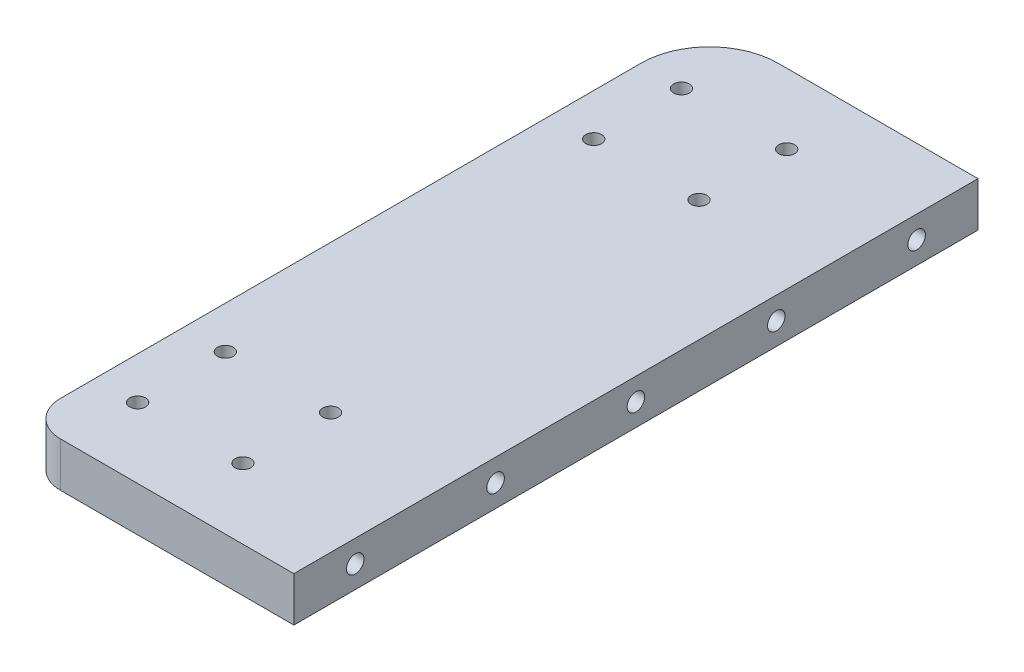
from build123d import *

# Parameters (mm, degrees)
SKETCH1_R                       = 2.25
BOSS_EXTRUDE1_DEPTH             = 12.7
TAP_DRILL_FOR_M6X1_0_TAP1_D     = 5
TAP_DRILL_FOR_M6X1_0_TAP1_DEPTH = 17
TAP_DRILL_FOR_M6X1_0_TAP1_TIP   = 1.502151548


with BuildPart() as part:
    # Sketch1 → Boss-Extrude1 (new body)
    with BuildSketch(Plane(origin=(0, 0, 0), x_dir=(1, 0, 0), z_dir=(0, 1, 0))):
        with BuildLine():
            Line((43.025, 97.5), (43.025, -97.5))
            Line((43.025, -97.5), (-23.5, -97.5))
            ThreePointArc((-23.5, -97.5), (-30.571067812, -94.571067812), (-33.5, -87.5))
            Line((-33.5, -87.5), (-33.5, 77.975))
            ThreePointArc((-33.5, 77.975), (-27.781259903, 91.781259903), (-13.975, 97.5))
            Line((-13.975, 97.5), (43.025, 97.5))
        make_face()
        with Locations((-21.5, -77.5)):
            Circle(SKETCH1_R, mode=Mode.SUBTRACT)
        with Locations((8.5, -77.5)):
            Circle(SKETCH1_R, mode=Mode.SUBTRACT)
        with Locations((8.5, -52.5)):
            Circle(SKETCH1_R, mode=Mode.SUBTRACT)
        with Locations((-21.5, -52.5)):
            Circle(SKETCH1_R, mode=Mode.SUBTRACT)
        with Locations((-21.5, 52.5)):
            Circle(SKETCH1_R, mode=Mode.SUBTRACT)
        with Locations((-21.5, 77.5)):
            Circle(SKETCH1_R, mode=Mode.SUBTRACT)
        with Locations((8.5, 77.5)):
            Circle(SKETCH1_R, mode=Mode.SUBTRACT)
        with Locations((8.5, 52.5)):
            Circle(SKETCH1_R, mode=Mode.SUBTRACT)
    extrude(amount=BOSS_EXTRUDE1_DEPTH)

    # Tap Drill for M6x1.0 Tap1
    with Locations(Plane(origin=(43.025, 0, 0), x_dir=(0, 0, -1), z_dir=(1, 0, 0))):
        with Locations((-80, 6.35), (-40, 6.35), (0, 6.35), (40, 6.35), (80, 6.35)):
            Hole(TAP_DRILL_FOR_M6X1_0_TAP1_D / 2, depth=TAP_DRILL_FOR_M6X1_0_TAP1_DEPTH)
            with Locations((0, 0, -(TAP_DRILL_FOR_M6X1_0_TAP1_DEPTH + TAP_DRILL_FOR_M6X1_0_TAP1_TIP / 2))):  # 118° drill point
                Cone(0, TAP_DRILL_FOR_M6X1_0_TAP1_D / 2, TAP_DRILL_FOR_M6X1_0_TAP1_TIP, mode=Mode.SUBTRACT)


solid = part.part
